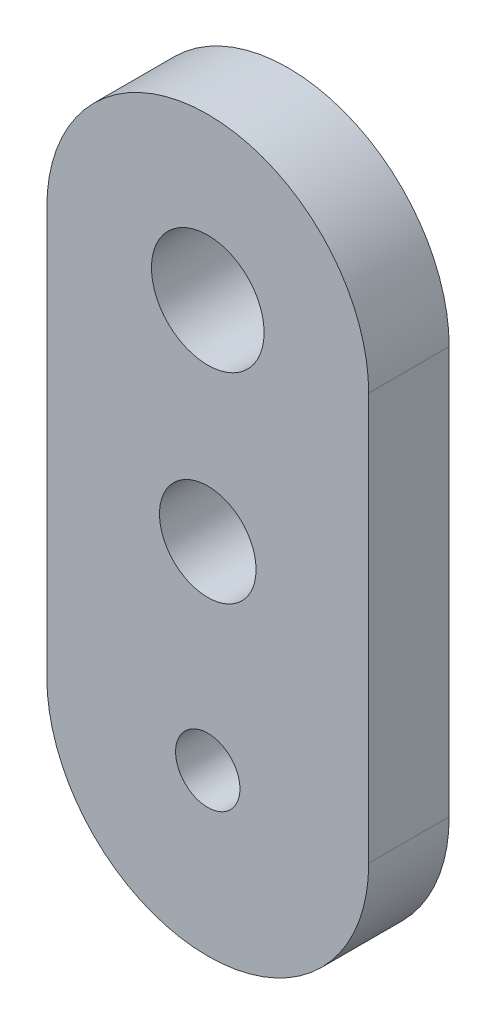
from build123d import *

# Parameters (mm, degrees)
SKETCH1_R           = 3.5
SKETCH1_R_2         = 3
SKETCH1_R_3         = 2
BOSS_EXTRUDE1_DEPTH = 5


with BuildPart() as part:
    # Sketch1 → Boss-Extrude1 (new body)
    with BuildSketch(Plane.XY):
        with BuildLine():
            Line((10, 0), (10, -25.3))
            ThreePointArc((10, -25.3), (0, -35.3), (-10, -25.3))
            Line((-10, -25.3), (-10, 0))
            ThreePointArc((-10, 0), (0, 10), (10, 0))
        make_face()
        Circle(SKETCH1_R, mode=Mode.SUBTRACT)
        with Locations((0, -13)):
            Circle(SKETCH1_R_2, mode=Mode.SUBTRACT)
        with Locations((0, -25.3)):
            Circle(SKETCH1_R_3, mode=Mode.SUBTRACT)
    extrude(amount=BOSS_EXTRUDE1_DEPTH)


solid = part.part
